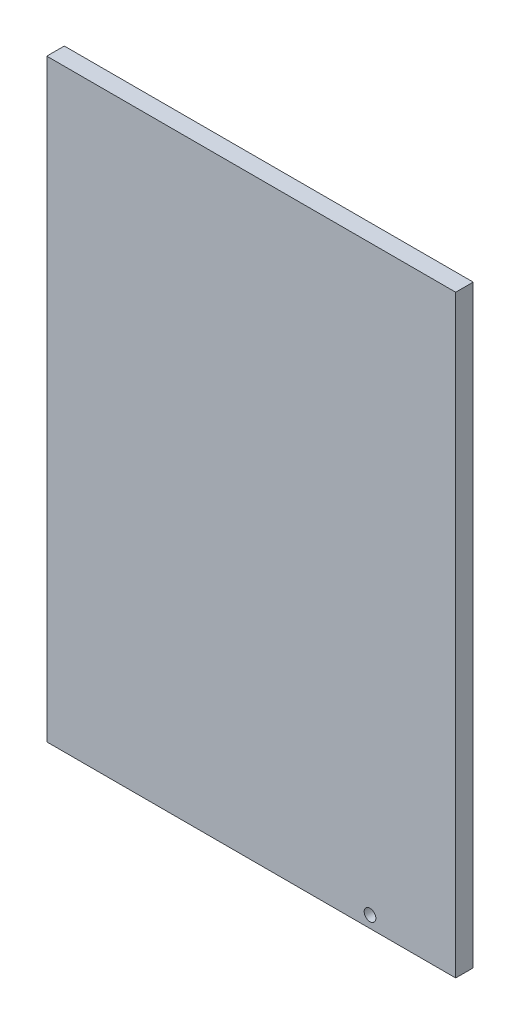
from build123d import *

# Parameters (mm, degrees)
SKETCH1_W           = 210
SKETCH1_H           = 305
BOSS_EXTRUDE1_DEPTH = 9
SKETCH2_R           = 3
CUT_EXTRUDE1_DEPTH  = 186.370574795


with BuildPart() as part:
    # Sketch1 → Boss-Extrude1 (new body)
    with BuildSketch(Plane.XY):
        Rectangle(SKETCH1_W, SKETCH1_H)
    extrude(amount=BOSS_EXTRUDE1_DEPTH)

    # Sketch2 → Cut-Extrude1 (cut, through all)
    with BuildSketch(Plane.XY.offset(9)):
        with Locations((61, -146.5)):
            Circle(SKETCH2_R)
    extrude(amount=-CUT_EXTRUDE1_DEPTH, mode=Mode.SUBTRACT)


solid = part.part
